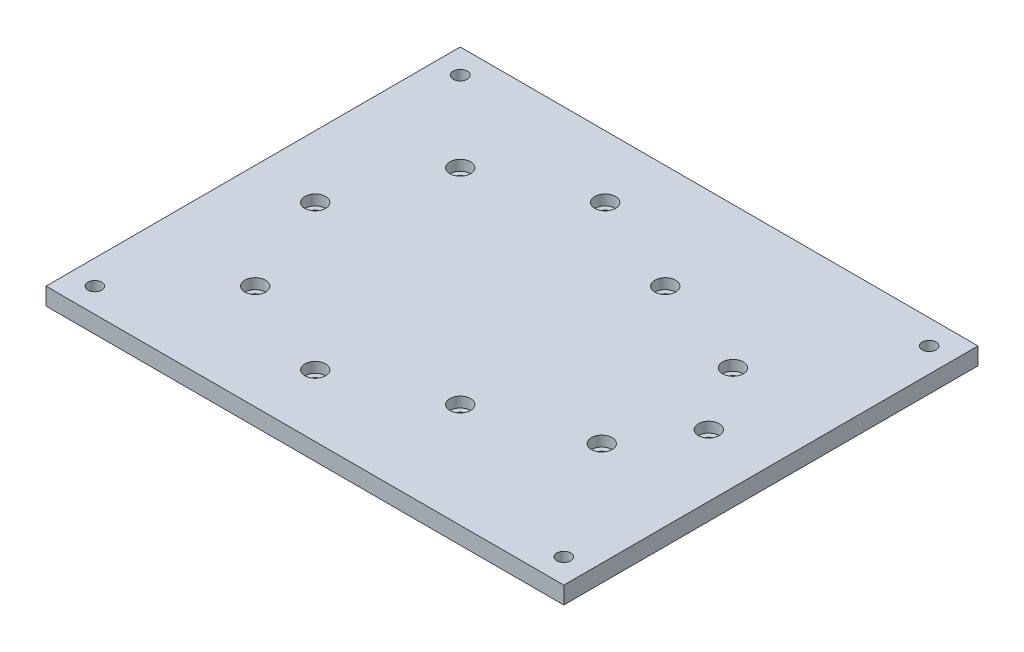
from build123d import *

# Parameters (mm, degrees)
SKETCH1_W           = 150
SKETCH1_H           = 120
SKETCH1_R           = 1.55
SKETCH1_R_2         = 2.05
SKETCH1_R_3         = 2
BOSS_EXTRUDE1_DEPTH = 5
SKETCH2_R           = 3
CUT_EXTRUDE1_DEPTH  = 3


with BuildPart() as part:
    # Sketch1 → Boss-Extrude1 (new body)
    with BuildSketch(Plane(origin=(0, 0, 0), x_dir=(1, 0, 0), z_dir=(0, 1, 0))):
        with Locations((-2e-09, 2e-09)):
            Rectangle(SKETCH1_W, SKETCH1_H)
        with Locations((14.69848481, 29.69848481)):
            Circle(SKETCH1_R, mode=Mode.SUBTRACT)
        with Locations((-15, 42)):
            Circle(SKETCH1_R, mode=Mode.SUBTRACT)
        with Locations((-44.69848481, 29.69848481)):
            Circle(SKETCH1_R, mode=Mode.SUBTRACT)
        with Locations((-57, 0)):
            Circle(SKETCH1_R, mode=Mode.SUBTRACT)
        with Locations((-44.69848481, -29.69848481)):
            Circle(SKETCH1_R, mode=Mode.SUBTRACT)
        with Locations((-15, -42)):
            Circle(SKETCH1_R, mode=Mode.SUBTRACT)
        with Locations((14.69848481, -29.69848481)):
            Circle(SKETCH1_R, mode=Mode.SUBTRACT)
        with Locations((45, -19)):
            Circle(SKETCH1_R, mode=Mode.SUBTRACT)
        with Locations((57, 0)):
            Circle(SKETCH1_R, mode=Mode.SUBTRACT)
        with Locations((45, 19)):
            Circle(SKETCH1_R, mode=Mode.SUBTRACT)
        with Locations((-67.92893219, 52.92893219)):
            Circle(SKETCH1_R_2, mode=Mode.SUBTRACT)
        with Locations((67.928932186, -52.928932186)):
            Circle(SKETCH1_R_3, mode=Mode.SUBTRACT)
        with Locations((-67.92893219, -52.928932186)):
            Circle(SKETCH1_R_3, mode=Mode.SUBTRACT)
        with Locations((67.928932186, 52.92893219)):
            Circle(SKETCH1_R_3, mode=Mode.SUBTRACT)
    extrude(amount=BOSS_EXTRUDE1_DEPTH)

    # Sketch2 → Cut-Extrude1 (cut)
    with BuildSketch(Plane(origin=(0, 5, 0), x_dir=(1, 0, 0), z_dir=(0, 1, 0))):
        with Locations((14.69848481, 29.69848481)):
            Circle(SKETCH2_R)
        with Locations((-15, 42)):
            Circle(SKETCH2_R)
        with Locations((-44.69848481, 29.69848481)):
            Circle(SKETCH2_R)
        with Locations((-57, 0)):
            Circle(SKETCH2_R)
        with Locations((-44.69848481, -29.69848481)):
            Circle(SKETCH2_R)
        with Locations((-15, -42)):
            Circle(SKETCH2_R)
        with Locations((14.69848481, -29.69848481)):
            Circle(SKETCH2_R)
        with Locations((45, -19)):
            Circle(SKETCH2_R)
        with Locations((57, 0)):
            Circle(SKETCH2_R)
        with Locations((45, 19)):
            Circle(SKETCH2_R)
    extrude(amount=-CUT_EXTRUDE1_DEPTH, mode=Mode.SUBTRACT)


solid = part.part
